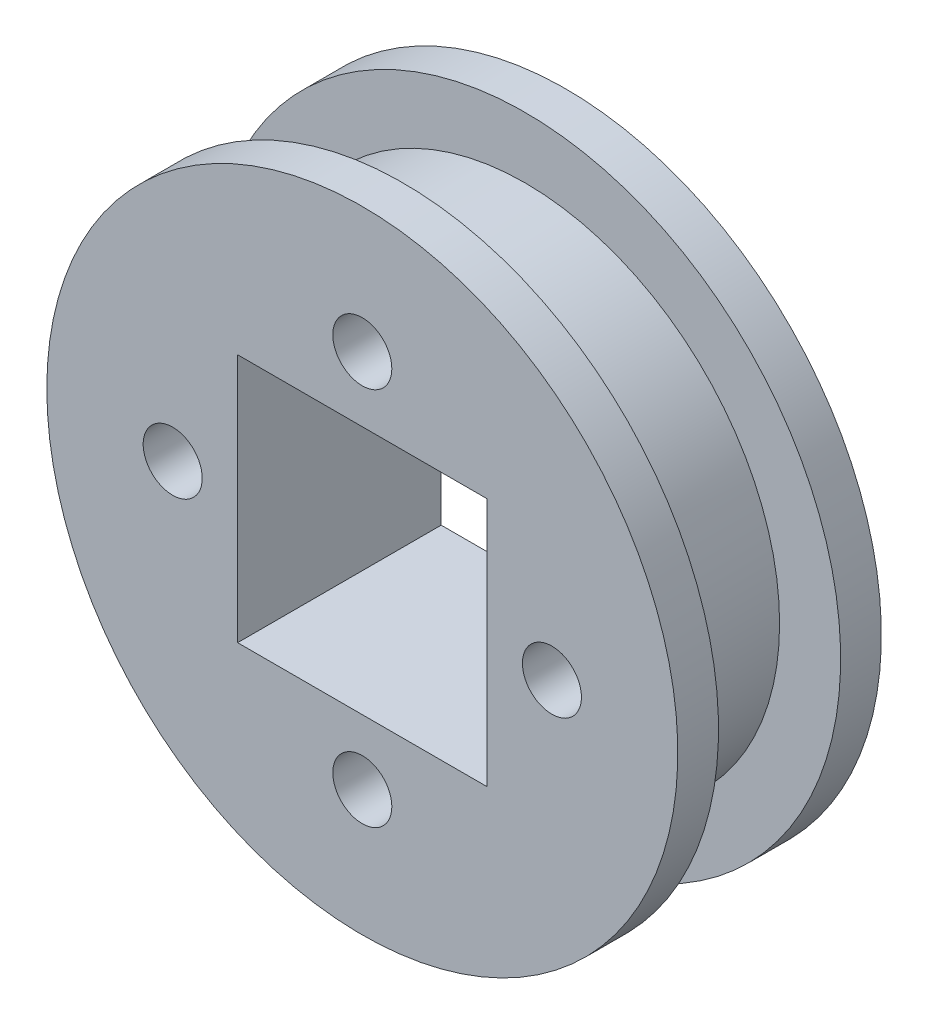
from build123d import *

# Parameters (mm, degrees)
SKETCH1_R           = 12.5
BOSS_EXTRUDE1_DEPTH = 4
SKETCH13_R          = 15.5
BOSS_EXTRUDE2_DEPTH = 2
LPATTERN1_COUNT     = 2
LPATTERN1_PITCH     = 8
CUT_EXTRUDE1_REACH  = 26.094
SKETCH8_W           = 12.25
SKETCH8_H           = 12.25
CUT_EXTRUDE4_REACH  = 26.094
SKETCH11_R          = 1.45


with BuildPart() as part:
    # Sketch1 → Boss-Extrude1 (new, symmetric)
    with BuildSketch(Plane.XY):
        Circle(SKETCH1_R)
    extrude(amount=BOSS_EXTRUDE1_DEPTH, both=True)

    # Sketch13 → Boss-Extrude2 (add)
    with BuildSketch(Plane(origin=(0, 0, -4), x_dir=(-1, 0, 0), z_dir=(0, 0, -1))):
        Circle(SKETCH13_R)
    boss_extrude2 = extrude(amount=BOSS_EXTRUDE2_DEPTH)

    # LPattern1: Boss-Extrude2 ×2
    with Locations(*[(0, 0, i * LPATTERN1_PITCH) for i in range(1, LPATTERN1_COUNT)]):
        add(boss_extrude2)

    # Sketch8 → Cut-Extrude1 (cut, up to next)
    with BuildSketch(Plane.XY.offset(4), mode=Mode.PRIVATE) as cut_extrude1_sk1:
        Rectangle(SKETCH8_W, SKETCH8_H)
    cut_extrude1_tool1 = extrude(cut_extrude1_sk1.sketch, amount=-CUT_EXTRUDE1_REACH, mode=Mode.PRIVATE) & part.part
    add(cut_extrude1_tool1.solids().sort_by_distance((0, 0, 4))[0], mode=Mode.SUBTRACT)

    # Sketch11 → Cut-Extrude4 (cut, up to next)
    with BuildSketch(Plane.XY.offset(4), mode=Mode.PRIVATE) as cut_extrude4_sk1:
        with Locations((9.315, 0)):
            Circle(SKETCH11_R)
    cut_extrude4_tool1 = extrude(cut_extrude4_sk1.sketch, amount=-CUT_EXTRUDE4_REACH, mode=Mode.PRIVATE) & part.part
    # Sketch11 → Cut-Extrude4 (cut, up to next)
    with BuildSketch(Plane.XY.offset(4), mode=Mode.PRIVATE) as cut_extrude4_sk2:
        with Locations((0, -9.315)):
            Circle(SKETCH11_R)
    cut_extrude4_tool2 = extrude(cut_extrude4_sk2.sketch, amount=-CUT_EXTRUDE4_REACH, mode=Mode.PRIVATE) & part.part
    # Sketch11 → Cut-Extrude4 (cut, up to next)
    with BuildSketch(Plane.XY.offset(4), mode=Mode.PRIVATE) as cut_extrude4_sk3:
        with Locations((-9.315, 0)):
            Circle(SKETCH11_R)
    cut_extrude4_tool3 = extrude(cut_extrude4_sk3.sketch, amount=-CUT_EXTRUDE4_REACH, mode=Mode.PRIVATE) & part.part
    # Sketch11 → Cut-Extrude4 (cut, up to next)
    with BuildSketch(Plane.XY.offset(4), mode=Mode.PRIVATE) as cut_extrude4_sk4:
        with Locations((0, 9.315)):
            Circle(SKETCH11_R)
    cut_extrude4_tool4 = extrude(cut_extrude4_sk4.sketch, amount=-CUT_EXTRUDE4_REACH, mode=Mode.PRIVATE) & part.part
    add(cut_extrude4_tool1.solids().sort_by_distance((9.315, 0, 4))[0], mode=Mode.SUBTRACT)
    add(cut_extrude4_tool2.solids().sort_by_distance((0, -9.315, 4))[0], mode=Mode.SUBTRACT)
    add(cut_extrude4_tool3.solids().sort_by_distance((-9.315, 0, 4))[0], mode=Mode.SUBTRACT)
    add(cut_extrude4_tool4.solids().sort_by_distance((0, 9.315, 4))[0], mode=Mode.SUBTRACT)


solid = part.part
